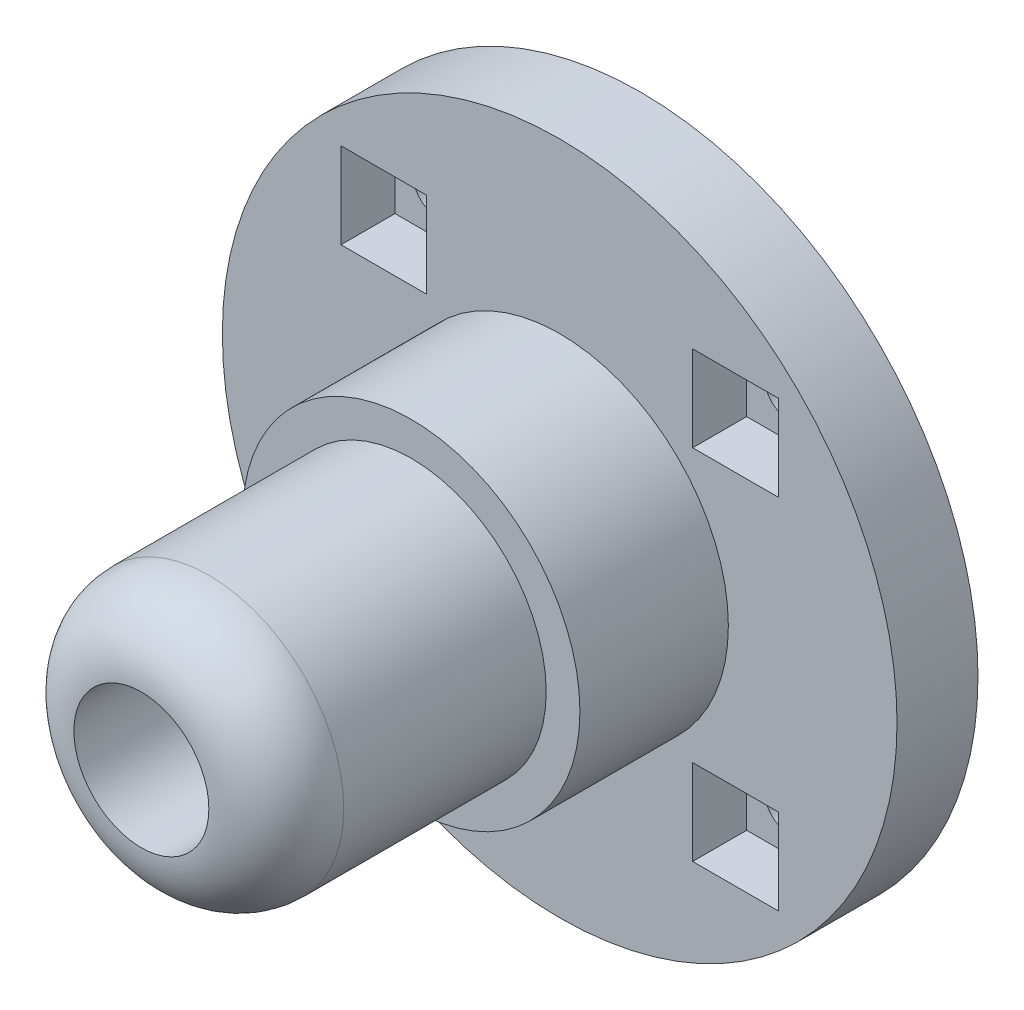
from build123d import *

# Parameters (mm, degrees)
SKETCH1_R           = 25
SKETCH1_R_2         = 1.85
SKETCH1_R_3         = 5
BOSS_EXTRUDE1_DEPTH = 6
SKETCH2_R           = 12.5
SKETCH2_R_2         = 5
BOSS_EXTRUDE2_DEPTH = 11
SKETCH3_R           = 10
SKETCH3_R_2         = 5
BOSS_EXTRUDE3_DEPTH = 20
FILLET1_R           = 5
SKETCH4_W           = 6.35
SKETCH4_H           = 6.35
CUT_EXTRUDE1_DEPTH  = 4


with BuildPart() as part:
    # Sketch1 → Boss-Extrude1 (new body)
    with BuildSketch(Plane.XY):
        Circle(SKETCH1_R)
        with Locations((-13.029498672, -13.274798425)):
            Circle(SKETCH1_R_2, mode=Mode.SUBTRACT)
        with Locations((13.029498672, -13.274798425)):
            Circle(SKETCH1_R_2, mode=Mode.SUBTRACT)
        with Locations((13.029498672, 13.274798425)):
            Circle(SKETCH1_R_2, mode=Mode.SUBTRACT)
        with Locations((-13.029498672, 13.274798425)):
            Circle(SKETCH1_R_2, mode=Mode.SUBTRACT)
        Circle(SKETCH1_R_3, mode=Mode.SUBTRACT)
    extrude(amount=BOSS_EXTRUDE1_DEPTH)

    # Sketch2 → Boss-Extrude2 (add)
    with BuildSketch(Plane.XY.offset(6)):
        Circle(SKETCH2_R)
        Circle(SKETCH2_R_2, mode=Mode.SUBTRACT)
    extrude(amount=BOSS_EXTRUDE2_DEPTH)

    # Sketch3 → Boss-Extrude3 (add)
    with BuildSketch(Plane.XY.offset(17)):
        Circle(SKETCH3_R)
        Circle(SKETCH3_R_2, mode=Mode.SUBTRACT)
    extrude(amount=BOSS_EXTRUDE3_DEPTH)

    # Fillet1
    fillet1_edges = [part.edges().sort_by_distance(p)[0] for p in [
        (-10, 0, 37),
    ]]
    fillet(fillet1_edges, radius=FILLET1_R - 0.0001)  # a hair under: the kernel refuses the full size

    # Sketch4 → Cut-Extrude1 (cut)
    with BuildSketch(Plane.XY.offset(6)):
        with Locations((13.029498672, -13.274798425)):
            Rectangle(SKETCH4_W, SKETCH4_H)
        with Locations((13.029498672, 13.274798425)):
            Rectangle(SKETCH4_W, SKETCH4_H)
        with Locations((-13.029498672, 13.274798425)):
            Rectangle(SKETCH4_W, SKETCH4_H)
        with Locations((-13.029498672, -13.274798425)):
            Rectangle(SKETCH4_W, SKETCH4_H)
    extrude(amount=-CUT_EXTRUDE1_DEPTH, mode=Mode.SUBTRACT)


solid = part.part
